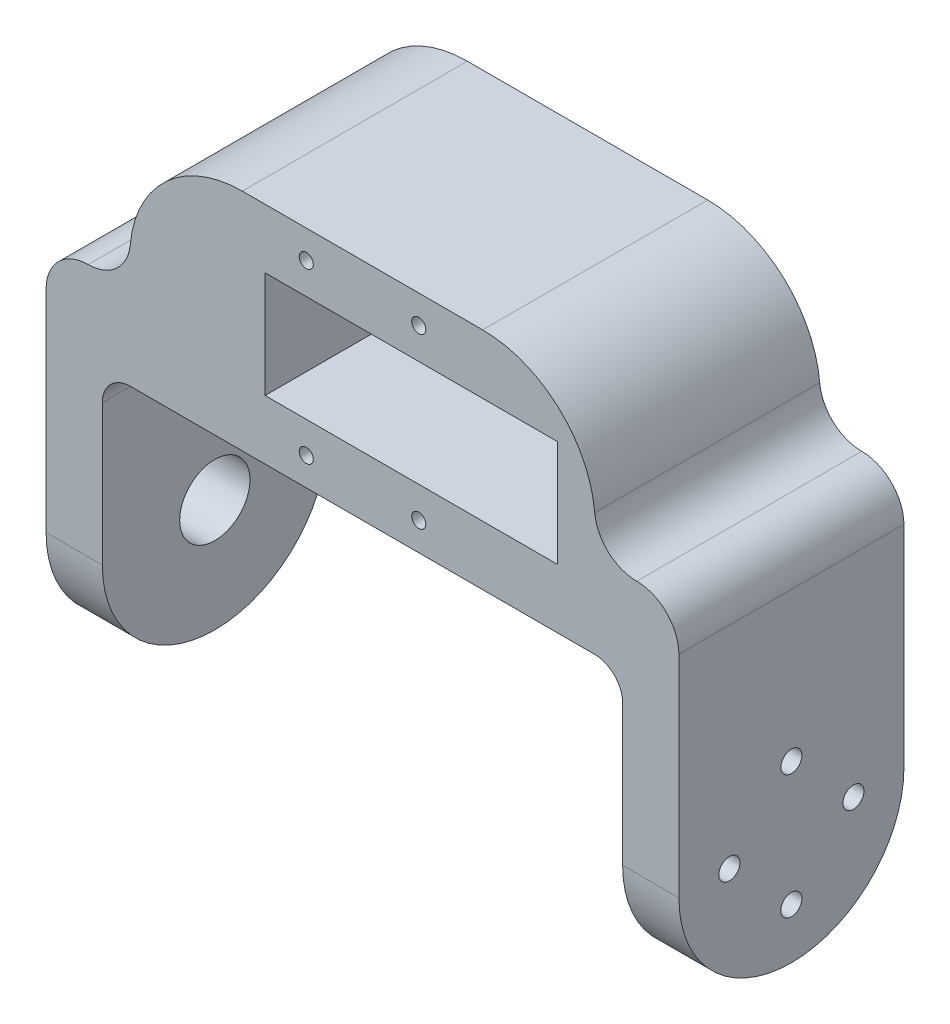
from build123d import *

# Parameters (mm, degrees)
BOSS_EXTRUDE1_DEPTH     = 25.4
FILLET1_R               = 3.175
FILLET2_R               = 12.7
SKETCH3_R               = 1.190625
CUT_EXTRUDE1_DEPTH      = 6.35
CIRPATTERN1_COUNT       = 4
SKETCH4_R               = 3.96875
CUT_EXTRUDE2_DEPTH      = 6.35
SKETCH5_R               = 3.175
CUT_EXTRUDE3_DEPTH      = 25.4
SKETCH6_W               = 24
SKETCH6_H               = 12
CUT_EXTRUDE4_DEPTH      = 23
SKETCH7_W               = 5
SKETCH7_H               = 12
SKETCH7_W_2             = 4
CUT_EXTRUDE5_DEPTH      = 19
FILLET6_R               = 0.396875
CUT_EXTRUDE6_DEPTH      = 95.331537177
CUT_EXTRUDE6_DEPTH_BACK = 4
SKETCH9_W               = 9.525
SKETCH9_H               = 15.875
CUT_EXTRUDE7_DEPTH      = 25.4
FILLET7_DEPTH           = 25.4
FILLET7_2_DEPTH         = 25.4
FILLET8_R               = 12.7
SKETCH10_R              = 0.79375
CUT_EXTRUDE8_DEPTH      = 12.7


with BuildPart() as part:
    # Sketch2 → Boss-Extrude1 (new body)
    with BuildSketch(Plane.XY):
        Polygon((0, 0), (0, 57.15), (71.4375, 57.15), (71.4375, 0), (65.0875, 0), (65.0875, 31.75), (6.35, 31.75), (6.35, 0), align=None)
    extrude(amount=BOSS_EXTRUDE1_DEPTH)

    # Fillet1
    fillet1_edges = [part.edges().sort_by_distance(p)[0] for p in [
        (65.0875, 31.75, 12.7),
        (6.35, 31.75, 12.7),
    ]]
    fillet(fillet1_edges, radius=FILLET1_R)

    # Fillet2
    fillet2_edges = [part.edges().sort_by_distance(p)[0] for p in [
        (3.175, 0, 0),
        (68.2625, 0, 0),
        (3.175, 0, 25.4),
        (68.2625, 0, 25.4),
    ]]
    fillet(fillet2_edges, radius=FILLET2_R - 0.0001)  # a hair under: the kernel refuses the full size

    # Sketch3 → Cut-Extrude1 (cut)
    with BuildSketch(Plane(origin=(71.4375, 0, 0), x_dir=(0, 0, -1), z_dir=(1, 0, 0))):
        with Locations(Location((-12.7, 19.7, 0), (0, 0, 90))):
            Circle(SKETCH3_R)
    cut_extrude1 = extrude(amount=-CUT_EXTRUDE1_DEPTH, mode=Mode.SUBTRACT)

    # CirPattern1: Cut-Extrude1 ×4 about axis
    cirpattern1_axis = Axis((0, 12.7, 12.7), (1, 0, 0))
    for i in range(1, CIRPATTERN1_COUNT):
        add(cut_extrude1.rotate(cirpattern1_axis, i * 360 / CIRPATTERN1_COUNT), mode=Mode.SUBTRACT)

    # Sketch4 → Cut-Extrude2 (cut)
    with BuildSketch(Plane.ZY):
        with Locations((12.7, 12.7)):
            Circle(SKETCH4_R)
    extrude(amount=-CUT_EXTRUDE2_DEPTH, mode=Mode.SUBTRACT)

    # Sketch5 → Cut-Extrude3 (cut)
    with BuildSketch(Plane.XY.offset(25.4)):
        with Locations((35.71875, 44.45)):
            Circle(SKETCH5_R)
    extrude(amount=-CUT_EXTRUDE3_DEPTH, mode=Mode.SUBTRACT)

    # Sketch6 → Cut-Extrude4 (cut)
    with BuildSketch(Plane.XY.offset(25.4)):
        with Locations((41.71875, 44.45)):
            Rectangle(SKETCH6_W, SKETCH6_H)
    extrude(amount=-CUT_EXTRUDE4_DEPTH, mode=Mode.SUBTRACT)

    # Sketch7 → Cut-Extrude5 (cut)
    with BuildSketch(Plane.XY.offset(25.4)):
        with Locations((27.21875, 44.45)):
            Rectangle(SKETCH7_W, SKETCH7_H)
        with Locations((55.71875, 44.45)):
            Rectangle(SKETCH7_W_2, SKETCH7_H)
    extrude(amount=-CUT_EXTRUDE5_DEPTH, mode=Mode.SUBTRACT)

    # Fillet6
    fillet6_edges = [part.edges().sort_by_distance(p)[0] for p in [
        (24.71875, 44.45, 6.4),
        (57.71875, 44.45, 6.4),
        (53.71875, 44.45, 2.4),
        (29.71875, 44.45, 2.4),
    ]]
    fillet(fillet6_edges, radius=FILLET6_R)

    # Sketch8 → Cut-Extrude6 (cut, two sides: drawn at the far end of the back side and taken through both)
    with BuildSketch(Plane.XY.offset(2.4).offset(-CUT_EXTRUDE6_DEPTH_BACK)):
        with BuildLine():
            Line((42.71875, 47.7), (40.76231025, 47.7))
            ThreePointArc((40.76231025, 47.7), (29.71875, 44.45), (40.76231025, 41.2))
            Line((40.76231025, 41.2), (42.71875, 41.2))
            ThreePointArc((42.71875, 41.2), (45.96875, 44.45), (42.71875, 47.7))
        make_face()
    extrude(amount=CUT_EXTRUDE6_DEPTH + CUT_EXTRUDE6_DEPTH_BACK, mode=Mode.SUBTRACT)

    # Sketch9 → Cut-Extrude7 (cut)
    with BuildSketch(Plane.XY.offset(25.4)):
        with Locations((4.7625, 49.2125)):
            Rectangle(SKETCH9_W, SKETCH9_H)
        with Locations((66.675, 49.2125)):
            Rectangle(SKETCH9_W, SKETCH9_H)
    extrude(amount=-CUT_EXTRUDE7_DEPTH, mode=Mode.SUBTRACT)

    # Fillet7: read off the stored shape, not the designer's step
    # Fillet7 outline → Fillet7 (cut)
    with BuildSketch(Plane.XY):
        with BuildLine():
            ThreePointArc((66.675, 41.275), (70.042596045, 39.880096045), (71.4375, 36.5125))
            Line((71.4375, 36.5125), (71.4375, 41.275))
            Line((71.4375, 41.275), (66.675, 41.275))
        make_face()
        with BuildLine():
            ThreePointArc((0, 36.5125), (1.394903955, 39.880096045), (4.7625, 41.275))
            Line((4.7625, 41.275), (0, 41.275))
            Line((0, 41.275), (0, 36.5125))
        make_face()
    extrude(amount=FILLET7_DEPTH, mode=Mode.SUBTRACT)

    # Fillet7 2 outline → Fillet7 2 (add)
    with BuildSketch(Plane.XY):
        with BuildLine():
            Line((61.9125, 41.275), (66.675, 41.275))
            ThreePointArc((66.675, 41.275), (63.307403955, 42.669903955), (61.9125, 46.0375))
            Line((61.9125, 46.0375), (61.9125, 41.275))
        make_face()
        with BuildLine():
            ThreePointArc((9.525, 46.0375), (8.130096045, 42.669903955), (4.7625, 41.275))
            Line((4.7625, 41.275), (9.525, 41.275))
            Line((9.525, 41.275), (9.525, 46.0375))
        make_face()
    extrude(amount=FILLET7_2_DEPTH)

    # Fillet8
    fillet8_edges = [part.edges().sort_by_distance(p)[0] for p in [
        (9.525, 57.15, 12.7),
        (61.9125, 57.15, 12.7),
    ]]
    fillet(fillet8_edges, radius=FILLET8_R)

    # Sketch10 → Cut-Extrude8 (cut)
    with BuildSketch(Plane.XY.offset(25.4)):
        with Locations((29.36875, 53.975)):
            Circle(SKETCH10_R)
        with Locations((42.06875, 53.975)):
            Circle(SKETCH10_R)
        with Locations((29.36875, 34.925)):
            Circle(SKETCH10_R)
        with Locations((42.06875, 34.925)):
            Circle(SKETCH10_R)
    extrude(amount=-CUT_EXTRUDE8_DEPTH, mode=Mode.SUBTRACT)


solid = part.part
